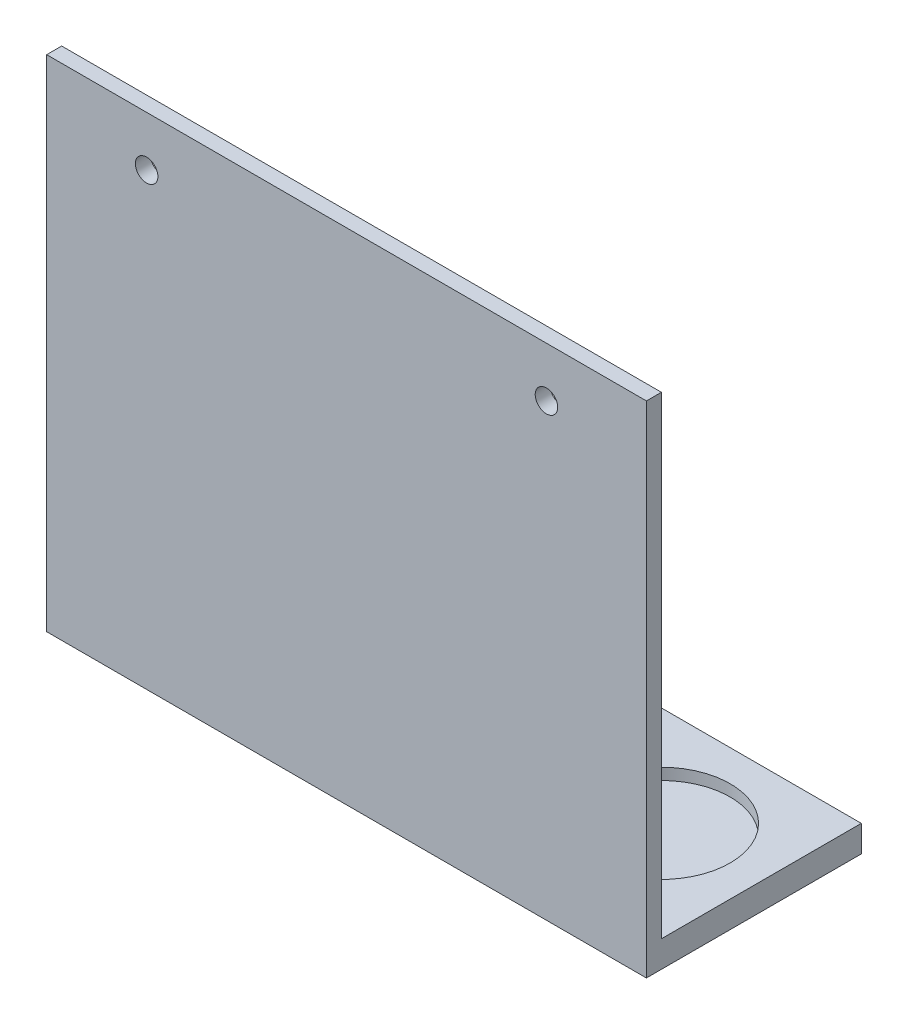
from build123d import *

# Parameters (mm, degrees)
SKETCH1_W           = 3
SKETCH1_H           = 100
BOSS_EXTRUDE1_DEPTH = 120
SKETCH8_R           = 2.25
CUT_EXTRUDE4_DEPTH  = 15
SKETCH9_W           = 120
SKETCH9_H           = 3
BOSS_EXTRUDE2_DEPTH = 40
SKETCH10_W          = 120
SKETCH10_H          = 40
SKETCH10_R          = 13.75
SKETCH10_R_2        = 7.6
SKETCH10_R_3        = 2.26
BOSS_EXTRUDE3_DEPTH = 2.3
SKETCH11_R          = 7
SKETCH11_R_2        = 2.25
SKETCH11_R_3        = 2.26
CUT_EXTRUDE5_DEPTH  = 161.181147455


with BuildPart() as part:
    # Sketch1 → Boss-Extrude1 (new body)
    with BuildSketch(Plane(origin=(0, 0, 0), x_dir=(0, 0, -1), z_dir=(1, 0, 0))):
        with Locations((1.5, 17)):
            Rectangle(SKETCH1_W, SKETCH1_H)
    extrude(amount=BOSS_EXTRUDE1_DEPTH)

    # Sketch8 → Cut-Extrude4 (cut)
    with BuildSketch(Plane.XY):
        with Locations((20, 57)):
            Circle(SKETCH8_R)
        with Locations((100, 57)):
            Circle(SKETCH8_R)
    extrude(amount=-CUT_EXTRUDE4_DEPTH, mode=Mode.SUBTRACT)

    # Sketch9 → Boss-Extrude2 (add)
    with BuildSketch(Plane(origin=(0, 0, -3), x_dir=(-1, 0, 0), z_dir=(0, 0, -1))):
        with Locations((-60, -31.5)):
            Rectangle(SKETCH9_W, SKETCH9_H)
    extrude(amount=BOSS_EXTRUDE2_DEPTH)

    # Sketch10 → Boss-Extrude3 (add)
    with BuildSketch(Plane(origin=(0, -30, 0), x_dir=(1, 0, 0), z_dir=(0, 1, 0))):
        with Locations((60, 23)):
            Rectangle(SKETCH10_W, SKETCH10_H)
        with Locations((100, 23)):
            Circle(SKETCH10_R, mode=Mode.SUBTRACT)
        with Locations((63, 23)):
            Circle(SKETCH10_R_2, mode=Mode.SUBTRACT)
        with Locations((26, 23)):
            Circle(SKETCH10_R_2, mode=Mode.SUBTRACT)
        with Locations((6, 23)):
            Circle(SKETCH10_R_3, mode=Mode.SUBTRACT)
    extrude(amount=BOSS_EXTRUDE3_DEPTH)

    # Sketch11 → Cut-Extrude5 (cut, through all)
    with BuildSketch(Plane(origin=(0, -30, 0), x_dir=(1, 0, 0), z_dir=(0, 1, 0))):
        with Locations((63, 23)):
            Circle(SKETCH11_R)
        with Locations((26, 23)):
            Circle(SKETCH11_R_2)
        with Locations((6, 23)):
            Circle(SKETCH11_R_3)
    extrude(amount=-CUT_EXTRUDE5_DEPTH, mode=Mode.SUBTRACT)


solid = part.part
